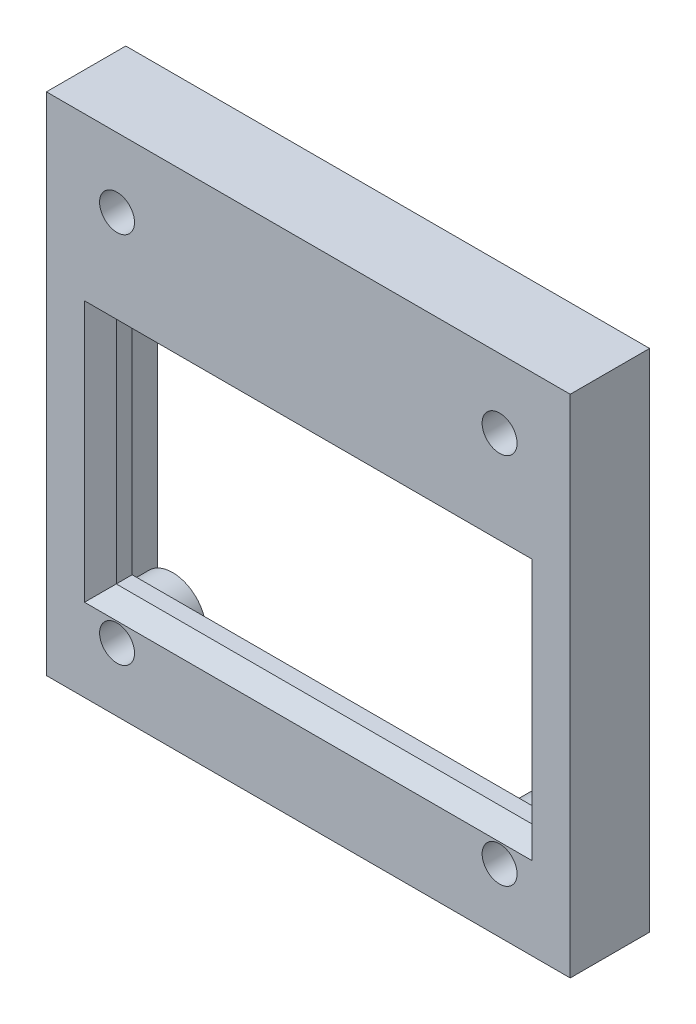
from build123d import *

# Parameters (mm, degrees)
SKETCH1_W           = 33
SKETCH1_H           = 31.85
SKETCH1_W_2         = 26.2
SKETCH1_H_2         = 14.45
BOSS_EXTRUDE1_DEPTH = 2
CHAMFER1_SIZE       = 1
SKETCH2_W           = 33
SKETCH2_H           = 31.85
SKETCH2_W_2         = 29
SKETCH2_H_2         = 27.85
BOSS_EXTRUDE2_DEPTH = 3
SKETCH3_R           = 1.1
CUT_EXTRUDE2_DEPTH  = 3
BOSS_EXTRUDE3_START = 1.5
SKETCH4_R           = 2.1
SKETCH4_R_2         = 1.1
BOSS_EXTRUDE3_DEPTH = 1.5


with BuildPart() as part:
    # Sketch1 → Boss-Extrude1 (new body)
    with BuildSketch(Plane.XY):
        with Locations((0, 2.5)):
            Rectangle(SKETCH1_W, SKETCH1_H)
        Rectangle(SKETCH1_W_2, SKETCH1_H_2, mode=Mode.SUBTRACT)
    extrude(amount=BOSS_EXTRUDE1_DEPTH)

    # Chamfer1
    chamfer1_edges = [part.edges().sort_by_distance(p)[0] for p in [
        (13.1, 0, 2),
        (0, -7.225, 2),
        (-13.1, 0, 2),
        (0, 7.225, 2),
    ]]
    chamfer(chamfer1_edges, length=CHAMFER1_SIZE)

    # Sketch2 → Boss-Extrude2 (add)
    with BuildSketch(Plane(origin=(0, 0, 0), x_dir=(-1, 0, 0), z_dir=(0, 0, -1))):
        with Locations((0, 2.5)):
            Rectangle(SKETCH2_W, SKETCH2_H)
        with Locations((0, 2.5)):
            Rectangle(SKETCH2_W_2, SKETCH2_H_2, mode=Mode.SUBTRACT)
    extrude(amount=BOSS_EXTRUDE2_DEPTH)

    # Sketch3 → Cut-Extrude2 (cut)
    with BuildSketch(Plane(origin=(0, 0, 0), x_dir=(-1, 0, 0), z_dir=(0, 0, -1))):
        with Locations((-12.05, 14.075)):
            Circle(SKETCH3_R)
        with Locations((12.05, 14.075)):
            Circle(SKETCH3_R)
        with Locations((-12.05, -9.425)):
            Circle(SKETCH3_R)
        with Locations((12.05, -9.425)):
            Circle(SKETCH3_R)
    extrude(amount=-CUT_EXTRUDE2_DEPTH, mode=Mode.SUBTRACT)

    # Sketch4 → Boss-Extrude3 (add)
    # profile 1 of 4: a face of its own
    with BuildSketch(Plane(origin=(0, 0, 0), x_dir=(-1, 0, 0), z_dir=(0, 0, -1)).offset(BOSS_EXTRUDE3_START)):
        with Locations((-12.05, 14.075)):
            Circle(SKETCH4_R)
        with Locations((-12.05, 14.075)):
            Circle(SKETCH4_R_2, mode=Mode.SUBTRACT)
    # profile 2 of 4: a face of its own
    with BuildSketch(Plane(origin=(0, 0, 0), x_dir=(-1, 0, 0), z_dir=(0, 0, -1)).offset(BOSS_EXTRUDE3_START)):
        with Locations((12.05, 14.075)):
            Circle(SKETCH4_R)
        with Locations((12.05, 14.075)):
            Circle(SKETCH4_R_2, mode=Mode.SUBTRACT)
    # profile 3 of 4: a face of its own
    with BuildSketch(Plane(origin=(0, 0, 0), x_dir=(-1, 0, 0), z_dir=(0, 0, -1)).offset(BOSS_EXTRUDE3_START)):
        with Locations((-12.05, -9.425)):
            Circle(SKETCH4_R)
        with Locations((-12.05, -9.425)):
            Circle(SKETCH4_R_2, mode=Mode.SUBTRACT)
    # profile 4 of 4: a face of its own
    with BuildSketch(Plane(origin=(0, 0, 0), x_dir=(-1, 0, 0), z_dir=(0, 0, -1)).offset(BOSS_EXTRUDE3_START)):
        with Locations((12.05, -9.425)):
            Circle(SKETCH4_R)
        with Locations((12.05, -9.425)):
            Circle(SKETCH4_R_2, mode=Mode.SUBTRACT)
    extrude(amount=-BOSS_EXTRUDE3_DEPTH)


solid = part.part
